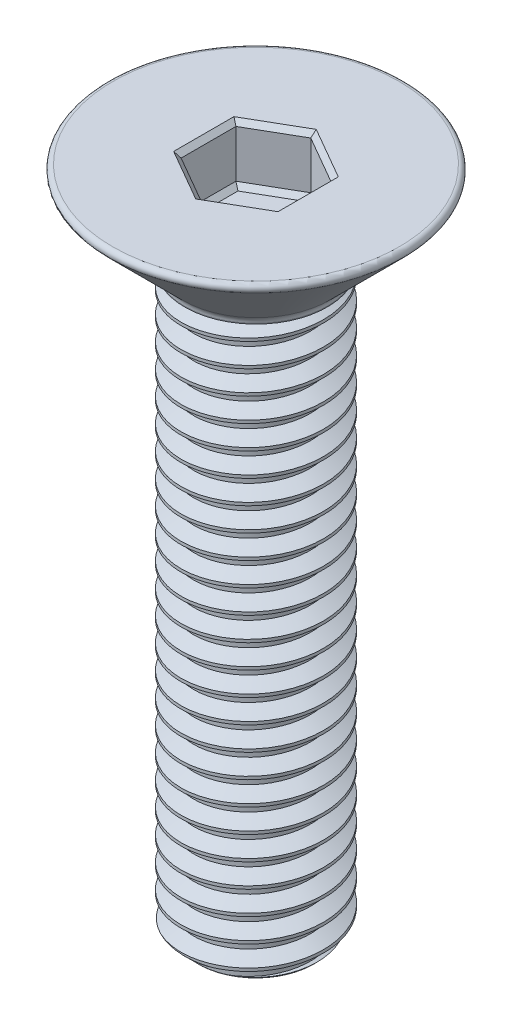
from build123d import *

# Parameters (mm, degrees)
SKETCH1_R           = 1.5
BOSS_EXTRUDE1_DEPTH = 12.14
THREAD1_PITCH       = 0.5
SKETCH5_R           = 1.5
BOSS_EXTRUDE2_DEPTH = 0.1
SKETCH6_R           = 1.5
BOSS_EXTRUDE3_DEPTH = 1.76
BOSS_EXTRUDE3_DRAFT = -45
FILLET1_R           = 0.1
FILLET2_R           = 0.2
CUT_EXTRUDE1_DEPTH  = 1.1
CHAMFER1_SIZE       = 0.1
CUT_EXTRUDE2_DEPTH  = 0.1
CUT_EXTRUDE2_DRAFT  = -45


with BuildPart() as part:
    # Sketch1 → Boss-Extrude1 (new body)
    with BuildSketch(Plane(origin=(0, 0, 0), x_dir=(1, 0, 0), z_dir=(0, 1, 0))):
        with Locations(Location((0, 0, 0), (0, 0, 270))):
            Circle(SKETCH1_R)
    extrude(amount=BOSS_EXTRUDE1_DEPTH)

    # Thread1: the profile of Thread Profile1 profile screwed along a right-hand helix of 26.28 turns, 6 arcs to a turn; built about Z, then put on its axis
    thread1_z = Axis((0, 0, 0), (0, 0, 1))
    thread1_corners = [(1.5003, 0, -0.000173205), (1.5003, 0, 0.437673204), (1.229367063, 0, 0.281249999), (1.229367063, 0, 0.156249999)]
    with BuildLine(mode=Mode.PRIVATE) as thread1_profile:
        Line(thread1_corners[0], thread1_corners[1])
        Line(thread1_corners[1], thread1_corners[2])
        Line(thread1_corners[2], thread1_corners[3])
        Line(thread1_corners[3], thread1_corners[0])
    thread1_cap = Face(thread1_profile.wire())
    thread1_turn_angles = [0, 30, 60, 90, 120, 150, 180, 210, 240, 270, 300, 330, 360]
    thread1_turn_weights = [1, 0.8660254037844387, 1, 0.8660254037844387, 1, 0.8660254037844387, 1, 0.8660254037844387, 1, 0.8660254037844387, 1, 0.8660254037844387, 1]
    thread1_turn_rails = [Edge.make_bspline([Vector(p[0], p[1], 0).rotate(thread1_z, thread1_turn_angles[k]) / thread1_turn_weights[k] + Vector(0, 0, p[2] + THREAD1_PITCH * thread1_turn_angles[k] / 360) for k in range(13)], [0, 0, 0, 1, 1, 2, 2, 3, 3, 4, 4, 5, 5, 6, 6, 6], 2, thread1_turn_weights) for p in thread1_corners]
    thread1_turn_sides = [Face.make_surface_from_curves(thread1_turn_rails[p[0]], thread1_turn_rails[p[1]]) for p in [(0, 1), (1, 2), (2, 3), (3, 0)]]
    thread1_last_angles = [9360, 9390, 9420, 9440.4, 9460.8]
    thread1_last_weights = [1, 0.8660254037844387, 1, 0.9372819894918881, 1]
    thread1_last_rails = [Edge.make_bspline([Vector(p[0], p[1], 0).rotate(thread1_z, thread1_last_angles[k]) / thread1_last_weights[k] + Vector(0, 0, p[2] + THREAD1_PITCH * thread1_last_angles[k] / 360) for k in range(5)], [0, 0, 0, 1, 1, 2, 2, 2], 2, thread1_last_weights) for p in thread1_corners]
    thread1_last_sides = [Face.make_surface_from_curves(thread1_last_rails[p[0]], thread1_last_rails[p[1]]) for p in [(0, 1), (1, 2), (2, 3), (3, 0)]]
    thread1 = Plane(origin=(0, 13.14, 0), x_dir=(-1, 0, 0), z_dir=(0, -1, 0)) * Solid(Shell([*[p.moved(Location((0, 0, THREAD1_PITCH * i))) for i in range(26) for p in thread1_turn_sides], *thread1_last_sides, thread1_cap, thread1_cap.rotate(thread1_z, 9460.8).moved(Location((0, 0, THREAD1_PITCH * 9460.8 / 360)))]))
    add(thread1, mode=Mode.SUBTRACT)

    # Sketch5 → Boss-Extrude2 (add)
    with BuildSketch(Plane(origin=(0, 12.14, 0), x_dir=(1, 0, 0), z_dir=(0, 1, 0))):
        with Locations(Location((0, 0, 0), (0, 0, 79.630240195))):
            Circle(SKETCH5_R)
    extrude(amount=BOSS_EXTRUDE2_DEPTH)


with BuildPart() as boss_extrude3_tool:
    # Sketch6 → Boss-Extrude3 (with draft: the straight prism first)
    with BuildSketch(Plane(origin=(0, 12.24, 0), x_dir=(1, 0, 0), z_dir=(0, 1, 0))):
        with Locations(Location((0, 0, 0), (0, 0, 79.630240195))):
            Circle(SKETCH6_R)
    extrude(amount=BOSS_EXTRUDE3_DEPTH)
    # Boss-Extrude3: the draft: its side faces are tilted about the plane it starts from
    boss_extrude3_sides = [boss_extrude3_tool.faces().sort_by_distance(p)[0] for p in [
        (-0.27, 13.12, 1.475499915),
    ]]
    draft(boss_extrude3_sides, Plane(origin=(0, 12.24, 0), x_dir=(1, 0, 0), z_dir=(0, 1, 0)), BOSS_EXTRUDE3_DRAFT)


with BuildPart() as part_1:
    add(part.part)

    # Boss-Extrude3: add boss_extrude3_tool
    add(boss_extrude3_tool.part)

    # Sketch7 → Cut-Revolve1 (revolve, cut)
    with BuildSketch(Plane.XY, mode=Mode.PRIVATE) as cut_revolve1_sk:
        Polygon((1.51, 0), (1.51, 0.3), (1.21, 0), align=None)
    revolve(cut_revolve1_sk.sketch.rotate(Axis((0, 0, 0), (0, 1, 0)), 135.522486844), axis=Axis((0, 0, 0), (0, 1, 0)), mode=Mode.SUBTRACT)

    # Fillet1
    fillet1_edges = [part_1.edges().sort_by_distance(p)[0] for p in [
        (-0.5868, 14, 3.206753149),
    ]]
    fillet(fillet1_edges, radius=FILLET1_R)

    # Fillet2
    fillet2_edges = [part_1.edges().sort_by_distance(p)[0] for p in [
        (-0.27, 12.24, 1.475499915),
    ]]
    fillet(fillet2_edges, radius=FILLET2_R)

    # Sketch8 → Cut-Extrude1 (cut)
    with BuildSketch(Plane(origin=(0, 14, 0), x_dir=(1, 0, 0), z_dir=(0, 1, 0))):
        Polygon((0, 1.154700538), (-1, 0.577350269), (-1, -0.577350269), (0, -1.154700538), (1, -0.577350269), (1, 0.577350269), align=None)
    extrude(amount=-CUT_EXTRUDE1_DEPTH, mode=Mode.SUBTRACT)

    # Chamfer1
    chamfer1_edges = [part_1.edges().sort_by_distance(p)[0] for p in [
        (0.5, 14, -0.866025404),
        (-0.5, 14, -0.866025404),
        (-1, 14, 0),
        (-0.5, 14, 0.866025404),
        (0.5, 14, 0.866025404),
        (1, 14, 0),
    ]]
    chamfer(chamfer1_edges, length=CHAMFER1_SIZE)


with BuildPart() as cut_extrude2_tool:
    # Sketch9 → Cut-Extrude2 (with draft: the straight prism first)
    with BuildSketch(Plane(origin=(0, 12.9, 0), x_dir=(1, 0, 0), z_dir=(0, 1, 0))):
        Polygon((0, 1.154700538), (-1, 0.577350269), (-1, -0.577350269), (0, -1.154700538), (1, -0.577350269), (1, 0.577350269), align=None)
    extrude(amount=-CUT_EXTRUDE2_DEPTH)
    # Cut-Extrude2: the draft: its side faces are tilted about the plane it starts from
    cut_extrude2_sides = [cut_extrude2_tool.faces().sort_by_distance(p)[0] for p in [
        (-0.5, 12.85, -0.866025404),
        (-1, 12.85, 0),
        (-0.5, 12.85, 0.866025404),
        (0.5, 12.85, 0.866025404),
        (1, 12.85, 0),
        (0.5, 12.85, -0.866025404),
    ]]
    draft(cut_extrude2_sides, Plane(origin=(0, 12.9, 0), x_dir=(1, 0, 0), z_dir=(0, 1, 0)), CUT_EXTRUDE2_DRAFT)


with BuildPart() as part_2:
    add(part_1.part)

    # Cut-Extrude2: cut by cut_extrude2_tool
    add(cut_extrude2_tool.part, mode=Mode.SUBTRACT)


solid = part_2.part
